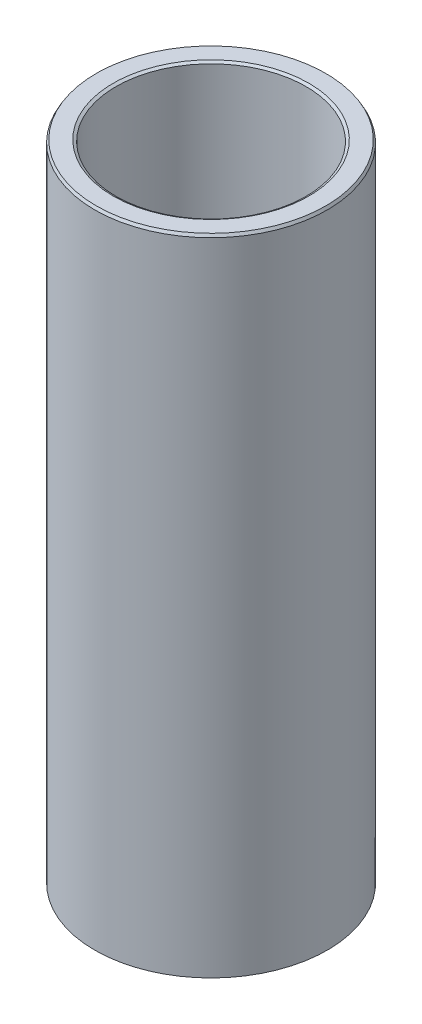
from build123d import *
from OCP.BRepFilletAPI import BRepFilletAPI_MakeChamfer

# Parameters (mm, degrees)
SKETCH1_R           = 52.5
BOSS_EXTRUDE1_DEPTH = 291.273279311
SKETCH2_R           = 42.918419766
CUT_EXTRUDE1_DEPTH  = 301.587130863
CHAMFER1_SIZE       = 1.221685339
CHAMFER1_SIZE2      = 0.705340359


with BuildPart() as part:
    # Sketch1 → Boss-Extrude1 (new body)
    with BuildSketch(Plane(origin=(0, 0, 0), x_dir=(1, 0, 0), z_dir=(0, 1, 0))):
        Circle(SKETCH1_R)
    extrude(amount=BOSS_EXTRUDE1_DEPTH)

    # Sketch2 → Cut-Extrude1 (cut, through all)
    with BuildSketch(Plane(origin=(0, 0, 0), x_dir=(1, 0, 0), z_dir=(0, 1, 0))):
        Circle(SKETCH2_R)
    extrude(amount=CUT_EXTRUDE1_DEPTH, mode=Mode.SUBTRACT)

    # Chamfer1: one chamfer whose edges measure the first distance from different faces: ONE call of the kernel's chamfer builder (chamfer() names one face for all edges)
    chamfer1_edges_1 = [part.edges().sort_by_distance(p)[0] for p in [
        (-42.918419766, 291.273279311, 0),
    ]]
    chamfer1_side_1 = [part.faces().sort_by_distance(p)[0] for p in [
        (-51.01507576, 291.273279311, 0),
    ]]
    chamfer1_edges_2 = [part.edges().sort_by_distance(p)[0] for p in [
        (-42.918419766, 0, 0),
    ]]
    chamfer1_side_2 = [part.faces().sort_by_distance(p)[0] for p in [
        (-42.918419766, 145.636639655, 0),
    ]]
    chamfer1_edges_3 = [part.edges().sort_by_distance(p)[0] for p in [
        (-52.5, 0, 0),
    ]]
    chamfer1_side_3 = [part.faces().sort_by_distance(p)[0] for p in [
        (-51.01507576, 0, 0),
    ]]
    chamfer1_edges_4 = [part.edges().sort_by_distance(p)[0] for p in [
        (-52.5, 291.273279311, 0),
    ]]
    chamfer1_side_4 = [part.faces().sort_by_distance(p)[0] for p in [
        (-52.5, 145.636639655, 0),
    ]]
    chamfer1 = BRepFilletAPI_MakeChamfer(part.part.solid().wrapped)
    for e in chamfer1_edges_1:
        chamfer1.Add(CHAMFER1_SIZE, CHAMFER1_SIZE2, e.wrapped, chamfer1_side_1[0].wrapped)  # the first distance lies on this face
    for e in chamfer1_edges_2:
        chamfer1.Add(CHAMFER1_SIZE, CHAMFER1_SIZE2, e.wrapped, chamfer1_side_2[0].wrapped)  # the first distance lies on this face
    for e in chamfer1_edges_3:
        chamfer1.Add(CHAMFER1_SIZE, CHAMFER1_SIZE2, e.wrapped, chamfer1_side_3[0].wrapped)  # the first distance lies on this face
    for e in chamfer1_edges_4:
        chamfer1.Add(CHAMFER1_SIZE, CHAMFER1_SIZE2, e.wrapped, chamfer1_side_4[0].wrapped)  # the first distance lies on this face
    add(Compound.cast(chamfer1.Shape()), mode=Mode.REPLACE)


solid = part.part
